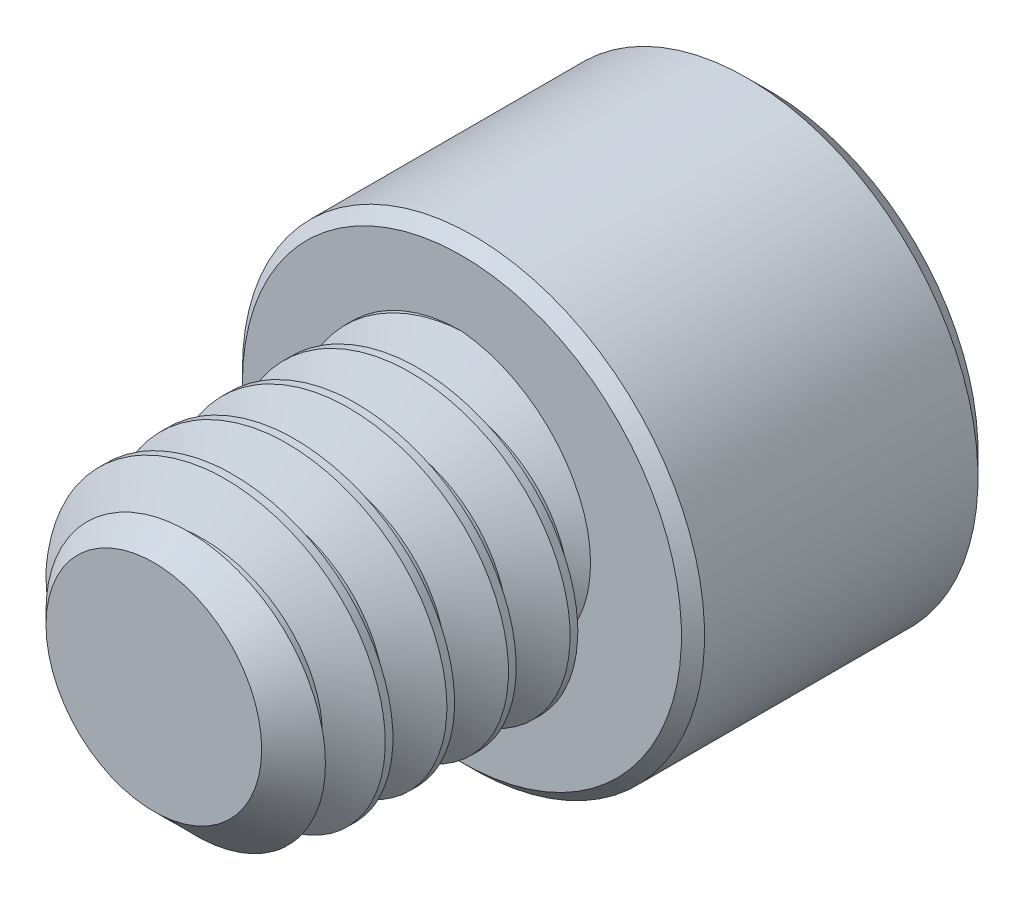
from build123d import *

# Parameters (mm, degrees)
SKETCH1_R          = 3.175
EXTRUDE1_DEPTH     = 6.35
CHAMFER3_SIZE      = 0.9525
CUT_SWEEP1_PITCH   = 1.27
SKETCH6_R          = 4.7625
EXTRUDE2_DEPTH     = 6.35
CUT_EXTRUDE1_DEPTH = 3.571875
CHAMFER1_SIZE      = 0.47625
CHAMFER2_SIZE      = 0.238125


with BuildPart() as part:
    # Sketch1 → Extrude1 (new body)
    with BuildSketch(Plane.XY):
        Circle(SKETCH1_R)
    extrude(amount=-EXTRUDE1_DEPTH)

    # Chamfer3
    chamfer3_edges = [part.edges().sort_by_distance(p)[0] for p in [
        (-3.175, 0, 0),
    ]]
    chamfer(chamfer3_edges, length=CHAMFER3_SIZE)

    # Cut-Sweep1: the profile of Sketch3 profile screwed along a right-hand helix of 6 turns, 6 arcs to a turn; built about Z, then put on its axis
    cut_sweep1_z = Axis((0, 0, 0), (0, 0, 1))
    cut_sweep1_corners = [(3.1753, 0, -1.111423205), (2.350110803, 0, -0.635), (2.350110803, 0, -0.47625), (3.1753, 0, 0.000173205)]
    with BuildLine(mode=Mode.PRIVATE) as cut_sweep1_profile:
        Line(cut_sweep1_corners[0], cut_sweep1_corners[1])
        Line(cut_sweep1_corners[1], cut_sweep1_corners[2])
        Line(cut_sweep1_corners[2], cut_sweep1_corners[3])
        Line(cut_sweep1_corners[3], cut_sweep1_corners[0])
    cut_sweep1_cap = Face(cut_sweep1_profile.wire())
    cut_sweep1_turn_angles = [0, 30, 60, 90, 120, 150, 180, 210, 240, 270, 300, 330, 360]
    cut_sweep1_turn_weights = [1, 0.8660254037844387, 1, 0.8660254037844387, 1, 0.8660254037844387, 1, 0.8660254037844387, 1, 0.8660254037844387, 1, 0.8660254037844387, 1]
    cut_sweep1_turn_rails = [Edge.make_bspline([Vector(p[0], p[1], 0).rotate(cut_sweep1_z, cut_sweep1_turn_angles[k]) / cut_sweep1_turn_weights[k] + Vector(0, 0, p[2] + CUT_SWEEP1_PITCH * cut_sweep1_turn_angles[k] / 360) for k in range(13)], [0, 0, 0, 1, 1, 2, 2, 3, 3, 4, 4, 5, 5, 6, 6, 6], 2, cut_sweep1_turn_weights) for p in cut_sweep1_corners]
    cut_sweep1_turn_sides = [Face.make_surface_from_curves(cut_sweep1_turn_rails[p[0]], cut_sweep1_turn_rails[p[1]]) for p in [(0, 1), (1, 2), (2, 3), (3, 0)]]
    cut_sweep1 = Plane(origin=(0, 0, 0), x_dir=(0, 1, 0), z_dir=(0, 0, -1)) * Solid(Shell([*[p.moved(Location((0, 0, CUT_SWEEP1_PITCH * i))) for i in range(6) for p in cut_sweep1_turn_sides], cut_sweep1_cap, cut_sweep1_cap.rotate(cut_sweep1_z, 2160).moved(Location((0, 0, CUT_SWEEP1_PITCH * 2160 / 360)))]))
    add(cut_sweep1, mode=Mode.SUBTRACT)

    # Sketch6 → Extrude2 (add)
    with BuildSketch(Plane(origin=(0, 0, -6.35), x_dir=(-1, 0, 0), z_dir=(0, 0, -1))):
        Circle(SKETCH6_R)
    extrude(amount=EXTRUDE2_DEPTH)

    # Sketch7 → Cut-Extrude1 (cut)
    with BuildSketch(Plane(origin=(0, 0, -12.7), x_dir=(-1, 0, 0), z_dir=(0, 0, -1))):
        Polygon((0, 2.749630657), (-2.38125, 1.374815329), (-2.38125, -1.374815329), (0, -2.749630657), (2.38125, -1.374815329), (2.38125, 1.374815329), align=None)
    extrude(amount=-CUT_EXTRUDE1_DEPTH, mode=Mode.SUBTRACT)

    # Cut-Extrude2 cone 1 section (through the dimple's axis) → Cut-Extrude2 (revolve, cut)
    with BuildSketch(Plane(origin=(0, 0, -12.7), x_dir=(0, 1, 0), z_dir=(1, 0, 0))):
        Polygon((0, 0), (2.749630657, 0), (0, 2.749630657), align=None)
    revolve(axis=Axis((0, 0, -12.7), (0, 0, 1)), mode=Mode.SUBTRACT)

    # Chamfer1
    chamfer1_edges = [part.edges().sort_by_distance(p)[0] for p in [
        (4.7625, 0, -12.7),
    ]]
    chamfer(chamfer1_edges, length=CHAMFER1_SIZE)

    # Chamfer2
    chamfer2_edges = [part.edges().sort_by_distance(p)[0] for p in [
        (4.7625, 0, -6.35),
    ]]
    chamfer(chamfer2_edges, length=CHAMFER2_SIZE)


solid = part.part
